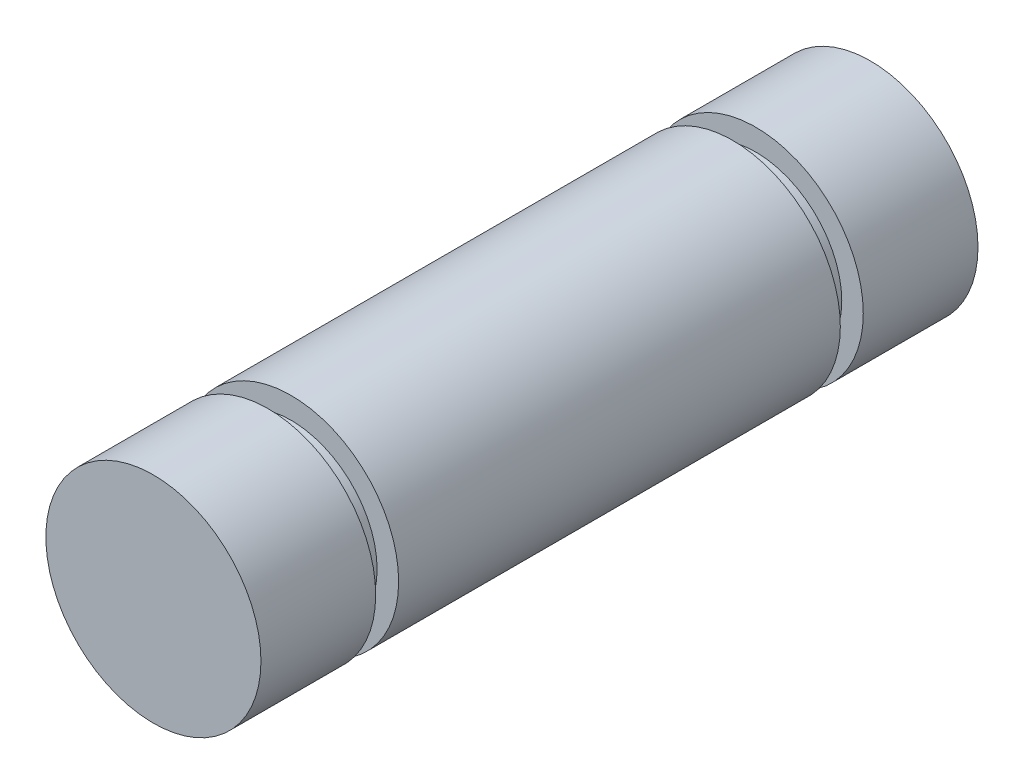
from build123d import *

# Parameters (mm, degrees)
SKETCH1_R           = 4.7625
BOSS_EXTRUDE1_DEPTH = 15.875
SKETCH2_W           = 0.9525
SKETCH2_H           = 1.016


with BuildPart() as part:
    # Sketch1 → Boss-Extrude1 (new, symmetric)
    with BuildSketch(Plane.XY):
        Circle(SKETCH1_R)
    extrude(amount=BOSS_EXTRUDE1_DEPTH, both=True)

    # Sketch2 → Cut-Revolve1 (revolve, cut)
    with BuildSketch(Plane(origin=(0, 0, 0), x_dir=(1, 0, 0), z_dir=(0, 1, 0))):
        with Locations((4.28625, 10.287)):
            Rectangle(SKETCH2_W, SKETCH2_H)
        with Locations((4.28625, -10.287)):
            Rectangle(SKETCH2_W, SKETCH2_H)
    revolve(axis=Axis((0, 0, 15.875), (0, 0, -1)), mode=Mode.SUBTRACT)


solid = part.part
